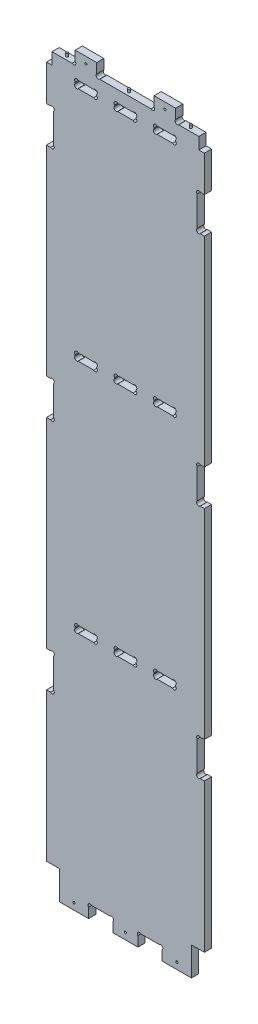
from build123d import *

# Parameters (mm, degrees)
BOSS_EXTRUDE1_DEPTH   = 10
SKETCH3_W             = 18
SKETCH3_H             = 40.02
CUT_EXTRUDE2_DEPTH    = 51
CAVITY2_START         = -19
CAVITY2_OUTLINE_W     = 80
CAVITY2_OUTLINE_H     = 10
CAVITY2_OUTLINE_R     = 1.5
CAVITY2_OUTLINE_W_2   = 32.3
CAVITY2_DEPTH         = 18
CAVITY2_START_2       = -1039.94
CAVITY2_2_OUTLINE_W   = 33.8
CAVITY2_2_OUTLINE_H   = 10
CAVITY2_2_OUTLINE_R   = 1.5
CAVITY2_2_DEPTH       = 18
CAVITY2_START_3       = -793.12
CAVITY2_3_OUTLINE_W   = 10
CAVITY2_3_OUTLINE_H   = 10
CAVITY2_3_DEPTH       = 50
CAVITY2_START_4       = -464.3
CAVITY2_4_OUTLINE_W   = 10
CAVITY2_4_OUTLINE_H   = 10
CAVITY2_4_DEPTH       = 50
CAVITY2_START_5       = -135.46
CAVITY2_5_OUTLINE_W   = 10
CAVITY2_5_OUTLINE_H   = 10
CAVITY2_5_DEPTH       = 50
CAVITY2_START_6       = -703.12
CAVITY2_6_DEPTH       = 10
CAVITY2_START_7       = -374.3
CAVITY2_7_DEPTH       = 10
CAVITY2_START_8       = -45.46
CAVITY2_8_DEPTH       = 10
F_3_0MM_DOWEL_HOLE1_D = 3
SKETCH7_R             = 3
CUT_EXTRUDE4_DEPTH    = 10
SKETCH6_W             = 80
SKETCH6_H             = 13.757359313
SKETCH6_W_2           = 32.3
CUT_EXTRUDE5_DEPTH    = 10
SKETCH8_W             = 30
SKETCH8_H             = 10
CUT_EXTRUDE6_DEPTH    = 10


# Read off the part's stored shape, not the designer's step: Cavity2
with BuildPart() as part:
    # Sketch1 → Boss-Extrude1 (new body)
    with BuildSketch(Plane.XY):
        Polygon((13, -35.36), (5.3, -35.36), (5.3, -1), (-199.3, -1), (-199.3, -35.36), (-207, -35.36), (-207, -1039.94), (13, -1039.94), align=None)
    extrude(amount=-BOSS_EXTRUDE1_DEPTH)

    # Sketch3 → Cut-Extrude2 (cut)
    with BuildSketch(Plane.XY):
        with Locations((-198, -1019.93)):
            Rectangle(SKETCH3_W, SKETCH3_H)
        with Locations((4, -1019.93)):
            Rectangle(SKETCH3_W, SKETCH3_H)
    extrude(amount=-CUT_EXTRUDE2_DEPTH, mode=Mode.SUBTRACT)

    # Cavity2 outline → Cavity2 (cut)
    # profile 1 of 3: a face of its own
    with BuildSketch(Plane(origin=(0, 0, 0), x_dir=(1, 0, 0), z_dir=(0, 1, 0)).offset(CAVITY2_START)):
        with Locations((-97, 5)):
            Rectangle(CAVITY2_OUTLINE_W, CAVITY2_OUTLINE_H)
        with Locations((-97, 5)):
            Circle(CAVITY2_OUTLINE_R, mode=Mode.SUBTRACT)
    # profile 2 of 3: a face of its own
    with BuildSketch(Plane(origin=(0, 0, 0), x_dir=(1, 0, 0), z_dir=(0, 1, 0)).offset(CAVITY2_START)):
        with Locations((-183.15, 5)):
            Rectangle(CAVITY2_OUTLINE_W_2, CAVITY2_OUTLINE_H)
        with Locations((-183.15, 5)):
            Circle(CAVITY2_OUTLINE_R, mode=Mode.SUBTRACT)
    # profile 3 of 3: a face of its own
    with BuildSketch(Plane(origin=(0, 0, 0), x_dir=(1, 0, 0), z_dir=(0, 1, 0)).offset(CAVITY2_START)):
        with Locations((-10.85, 5)):
            Rectangle(CAVITY2_OUTLINE_W_2, CAVITY2_OUTLINE_H)
        with Locations((-10.85, 5)):
            Circle(CAVITY2_OUTLINE_R, mode=Mode.SUBTRACT)
    extrude(amount=CAVITY2_DEPTH, mode=Mode.SUBTRACT)

    # Cavity2 2 outline → Cavity2 2 (cut)
    # profile 1 of 2: a face of its own
    with BuildSketch(Plane(origin=(0, 0, 0), x_dir=(1, 0, 0), z_dir=(0, 1, 0)).offset(CAVITY2_START_2)):
        with Locations((-131.4, 5)):
            Rectangle(CAVITY2_2_OUTLINE_W, CAVITY2_2_OUTLINE_H)
        with Locations((-131.4, 5)):
            Circle(CAVITY2_2_OUTLINE_R, mode=Mode.SUBTRACT)
    # profile 2 of 2: a face of its own
    with BuildSketch(Plane(origin=(0, 0, 0), x_dir=(1, 0, 0), z_dir=(0, 1, 0)).offset(CAVITY2_START_2)):
        with Locations((-62.6, 5)):
            Rectangle(CAVITY2_2_OUTLINE_W, CAVITY2_2_OUTLINE_H)
        with Locations((-62.6, 5)):
            Circle(CAVITY2_2_OUTLINE_R, mode=Mode.SUBTRACT)
    extrude(amount=CAVITY2_2_DEPTH, mode=Mode.SUBTRACT)

    # Cavity2 3 outline → Cavity2 3 (cut)
    with BuildSketch(Plane(origin=(0, 0, 0), x_dir=(1, 0, 0), z_dir=(0, 1, 0)).offset(CAVITY2_START_3)):
        with Locations((-202, 5)):
            Rectangle(CAVITY2_3_OUTLINE_W, CAVITY2_3_OUTLINE_H)
        with Locations((8, 5)):
            Rectangle(CAVITY2_3_OUTLINE_W, CAVITY2_3_OUTLINE_H)
    extrude(amount=CAVITY2_3_DEPTH, mode=Mode.SUBTRACT)

    # Cavity2 4 outline → Cavity2 4 (cut)
    with BuildSketch(Plane(origin=(0, 0, 0), x_dir=(1, 0, 0), z_dir=(0, 1, 0)).offset(CAVITY2_START_4)):
        with Locations((-202, 5)):
            Rectangle(CAVITY2_4_OUTLINE_W, CAVITY2_4_OUTLINE_H)
        with Locations((8, 5)):
            Rectangle(CAVITY2_4_OUTLINE_W, CAVITY2_4_OUTLINE_H)
    extrude(amount=CAVITY2_4_DEPTH, mode=Mode.SUBTRACT)

    # Cavity2 5 outline → Cavity2 5 (cut)
    with BuildSketch(Plane(origin=(0, 0, 0), x_dir=(1, 0, 0), z_dir=(0, 1, 0)).offset(CAVITY2_START_5)):
        with Locations((-202, 5)):
            Rectangle(CAVITY2_5_OUTLINE_W, CAVITY2_5_OUTLINE_H)
        with Locations((8, 5)):
            Rectangle(CAVITY2_5_OUTLINE_W, CAVITY2_5_OUTLINE_H)
    extrude(amount=CAVITY2_5_DEPTH, mode=Mode.SUBTRACT)

    # Cavity2 6 outline → Cavity2 6 (cut)
    with BuildSketch(Plane(origin=(0, 0, 0), x_dir=(1, 0, 0), z_dir=(0, 1, 0)).offset(CAVITY2_START_6)):
        with BuildLine():
            Line((-137, 0), (-137, 5.757359313))
            ThreePointArc((-137, 5.757359313), (-137.878679656, 7.878679657), (-137, 10))
            Line((-137, 10), (-167, 10))
            ThreePointArc((-167, 10), (-166.121320344, 7.878679657), (-167, 5.757359313))
            Line((-167, 5.757359313), (-167, 0))
            Line((-167, 0), (-137, 0))
        make_face()
        with BuildLine():
            Line((-112, 5.757359313), (-112, 0))
            Line((-112, 0), (-82, 0))
            Line((-82, 0), (-82, 5.757359313))
            ThreePointArc((-82, 5.757359313), (-82.878679656, 7.878679657), (-82, 10))
            Line((-82, 10), (-112, 10))
            ThreePointArc((-112, 10), (-111.121320344, 7.878679657), (-112, 5.757359313))
        make_face()
        with BuildLine():
            Line((-57, 5.757359313), (-57, 0))
            Line((-57, 0), (-27, 0))
            Line((-27, 0), (-27, 5.757359313))
            ThreePointArc((-27, 5.757359313), (-27.878679656, 7.878679657), (-27, 10))
            Line((-27, 10), (-57, 10))
            ThreePointArc((-57, 10), (-56.121320344, 7.878679657), (-57, 5.757359313))
        make_face()
    extrude(amount=CAVITY2_6_DEPTH, mode=Mode.SUBTRACT)

    # Cavity2 7 outline → Cavity2 7 (cut)
    with BuildSketch(Plane(origin=(0, 0, 0), x_dir=(1, 0, 0), z_dir=(0, 1, 0)).offset(CAVITY2_START_7)):
        with BuildLine():
            Line((-137, 0), (-137, 5.757359313))
            ThreePointArc((-137, 5.757359313), (-137.878679656, 7.878679657), (-137, 10))
            Line((-137, 10), (-167, 10))
            ThreePointArc((-167, 10), (-166.121320344, 7.878679657), (-167, 5.757359313))
            Line((-167, 5.757359313), (-167, 0))
            Line((-167, 0), (-137, 0))
        make_face()
        with BuildLine():
            Line((-112, 5.757359313), (-112, 0))
            Line((-112, 0), (-82, 0))
            Line((-82, 0), (-82, 5.757359313))
            ThreePointArc((-82, 5.757359313), (-82.878679656, 7.878679657), (-82, 10))
            Line((-82, 10), (-112, 10))
            ThreePointArc((-112, 10), (-111.121320344, 7.878679657), (-112, 5.757359313))
        make_face()
        with BuildLine():
            Line((-57, 5.757359313), (-57, 0))
            Line((-57, 0), (-27, 0))
            Line((-27, 0), (-27, 5.757359313))
            ThreePointArc((-27, 5.757359313), (-27.878679656, 7.878679657), (-27, 10))
            Line((-27, 10), (-57, 10))
            ThreePointArc((-57, 10), (-56.121320344, 7.878679657), (-57, 5.757359313))
        make_face()
    extrude(amount=CAVITY2_7_DEPTH, mode=Mode.SUBTRACT)

    # Cavity2 8 outline → Cavity2 8 (cut)
    with BuildSketch(Plane(origin=(0, 0, 0), x_dir=(1, 0, 0), z_dir=(0, 1, 0)).offset(CAVITY2_START_8)):
        with BuildLine():
            Line((-137, 0), (-137, 5.757359313))
            ThreePointArc((-137, 5.757359313), (-137.878679656, 7.878679657), (-137, 10))
            Line((-137, 10), (-167, 10))
            ThreePointArc((-167, 10), (-166.121320344, 7.878679657), (-167, 5.757359313))
            Line((-167, 5.757359313), (-167, 0))
            Line((-167, 0), (-137, 0))
        make_face()
        with BuildLine():
            Line((-112, 5.757359313), (-112, 0))
            Line((-112, 0), (-82, 0))
            Line((-82, 0), (-82, 5.757359313))
            ThreePointArc((-82, 5.757359313), (-82.878679656, 7.878679657), (-82, 10))
            Line((-82, 10), (-112, 10))
            ThreePointArc((-112, 10), (-111.121320344, 7.878679657), (-112, 5.757359313))
        make_face()
        with BuildLine():
            Line((-57, 5.757359313), (-57, 0))
            Line((-57, 0), (-27, 0))
            Line((-27, 0), (-27, 5.757359313))
            ThreePointArc((-27, 5.757359313), (-27.878679656, 7.878679657), (-27, 10))
            Line((-27, 10), (-57, 10))
            ThreePointArc((-57, 10), (-56.121320344, 7.878679657), (-57, 5.757359313))
        make_face()
    extrude(amount=CAVITY2_8_DEPTH, mode=Mode.SUBTRACT)

    # Ø3.0mm Dowel Hole1 (through all)
    with Locations(Plane.XY):
        with Locations((-25.35, -1030.94), (-152, -10), (-42, -10), (-168.65, -1030.94), (-97, -1030.94)):
            Hole(F_3_0MM_DOWEL_HOLE1_D / 2)

    # Sketch7 → Cut-Extrude4 (cut)
    with BuildSketch(Plane.XY):
        with Locations((-134.878679656, -16.878679657)):
            Circle(SKETCH7_R)
        with Locations((-59.121320344, -16.878679657)):
            Circle(SKETCH7_R)
        with Locations((5.121320344, -133.338679656)):
            Circle(SKETCH7_R)
        with Locations((5.121320344, -87.581320344)):
            Circle(SKETCH7_R)
        with Locations((5.121320344, -416.421320344)):
            Circle(SKETCH7_R)
        with Locations((5.121320344, -462.178679657)):
            Circle(SKETCH7_R)
        with Locations((5.121320344, -790.998679657)):
            Circle(SKETCH7_R)
        with Locations((5.121320344, -745.241320344)):
            Circle(SKETCH7_R)
        with Locations((-199.121320344, -790.998679657)):
            Circle(SKETCH7_R)
        with Locations((-199.121320344, -745.241320344)):
            Circle(SKETCH7_R)
        with Locations((-199.121320344, -462.178679657)):
            Circle(SKETCH7_R)
        with Locations((-199.121320344, -416.421320344)):
            Circle(SKETCH7_R)
        with Locations((-199.121320344, -87.581320344)):
            Circle(SKETCH7_R)
        with Locations((-199.121320344, -133.338679656)):
            Circle(SKETCH7_R)
        with Locations((-146.178679656, -1024.061320344)):
            Circle(SKETCH7_R)
        with Locations((-116.621320344, -1024.061320344)):
            Circle(SKETCH7_R)
        with Locations((-77.378679656, -1024.061320344)):
            Circle(SKETCH7_R)
        with Locations((-47.821320344, -1024.061320344)):
            Circle(SKETCH7_R)
        with Locations((-169.121320344, -16.878679657)):
            Circle(SKETCH7_R)
        with Locations((-24.878679656, -16.878679657)):
            Circle(SKETCH7_R)
        with BuildLine():
            ThreePointArc((-164.034165929, -40.46), (-164.878679656, -34.581320344), (-165.723193384, -40.46))
            ThreePointArc((-165.723193384, -40.46), (-164.878679656, -46.338679656), (-164.034165929, -40.46))
        make_face()
        with BuildLine():
            ThreePointArc((-55.723193384, -40.46), (-54.878679656, -46.338679656), (-54.034165929, -40.46))
            ThreePointArc((-54.034165929, -40.46), (-54.878679656, -34.581320344), (-55.723193384, -40.46))
        make_face()
        with BuildLine():
            ThreePointArc((-138.276806616, -40.46), (-139.121320344, -34.581320344), (-139.965834071, -40.46))
            ThreePointArc((-139.965834071, -40.46), (-139.121320344, -46.338679656), (-138.276806616, -40.46))
        make_face()
        with BuildLine():
            ThreePointArc((-29.965834071, -40.46), (-29.121320344, -46.338679656), (-28.276806616, -40.46))
            ThreePointArc((-28.276806616, -40.46), (-29.121320344, -34.581320344), (-29.965834071, -40.46))
        make_face()
        with BuildLine():
            ThreePointArc((-110.723193384, -40.46), (-109.878679656, -46.338679656), (-109.034165929, -40.46))
            ThreePointArc((-109.034165929, -40.46), (-109.878679656, -34.581320344), (-110.723193384, -40.46))
        make_face()
        with BuildLine():
            ThreePointArc((-84.965834071, -40.46), (-84.121320344, -46.338679656), (-83.276806616, -40.46))
            ThreePointArc((-83.276806616, -40.46), (-84.121320344, -34.581320344), (-84.965834071, -40.46))
        make_face()
        with BuildLine():
            ThreePointArc((-164.034165929, -369.3), (-164.878679656, -363.421320344), (-165.723193384, -369.3))
            ThreePointArc((-165.723193384, -369.3), (-164.878679656, -375.178679657), (-164.034165929, -369.3))
        make_face()
        with BuildLine():
            ThreePointArc((-138.276806616, -369.3), (-139.121320344, -363.421320344), (-139.965834071, -369.3))
            ThreePointArc((-139.965834071, -369.3), (-139.121320344, -375.178679657), (-138.276806616, -369.3))
        make_face()
        with BuildLine():
            ThreePointArc((-109.034165929, -369.3), (-109.878679656, -363.421320344), (-110.723193384, -369.3))
            ThreePointArc((-110.723193384, -369.3), (-109.878679656, -375.178679657), (-109.034165929, -369.3))
        make_face()
        with BuildLine():
            ThreePointArc((-83.276806616, -369.3), (-84.121320344, -363.421320344), (-84.965834071, -369.3))
            ThreePointArc((-84.965834071, -369.3), (-84.121320344, -375.178679657), (-83.276806616, -369.3))
        make_face()
        with BuildLine():
            ThreePointArc((-54.034165929, -369.3), (-54.878679656, -363.421320344), (-55.723193384, -369.3))
            ThreePointArc((-55.723193384, -369.3), (-54.878679656, -375.178679657), (-54.034165929, -369.3))
        make_face()
        with BuildLine():
            ThreePointArc((-28.276806616, -369.3), (-29.121320344, -363.421320344), (-29.965834071, -369.3))
            ThreePointArc((-29.965834071, -369.3), (-29.121320344, -375.178679657), (-28.276806616, -369.3))
        make_face()
        with BuildLine():
            ThreePointArc((-164.034165929, -698.12), (-164.878679656, -692.241320344), (-165.723193384, -698.12))
            ThreePointArc((-165.723193384, -698.12), (-164.878679656, -703.998679657), (-164.034165929, -698.12))
        make_face()
        with BuildLine():
            ThreePointArc((-139.965834071, -698.12), (-139.121320344, -703.998679657), (-138.276806616, -698.12))
            ThreePointArc((-138.276806616, -698.12), (-139.121320344, -692.241320344), (-139.965834071, -698.12))
        make_face()
        with BuildLine():
            ThreePointArc((-109.034165929, -698.12), (-109.878679656, -692.241320344), (-110.723193384, -698.12))
            ThreePointArc((-110.723193384, -698.12), (-109.878679656, -703.998679657), (-109.034165929, -698.12))
        make_face()
        with BuildLine():
            ThreePointArc((-84.965834071, -698.12), (-84.121320344, -703.998679657), (-83.276806616, -698.12))
            ThreePointArc((-83.276806616, -698.12), (-84.121320344, -692.241320344), (-84.965834071, -698.12))
        make_face()
        with BuildLine():
            ThreePointArc((-54.034165929, -698.12), (-54.878679656, -692.241320344), (-55.723193384, -698.12))
            ThreePointArc((-55.723193384, -698.12), (-54.878679656, -703.998679657), (-54.034165929, -698.12))
        make_face()
        with BuildLine():
            ThreePointArc((-29.965834071, -698.12), (-29.121320344, -703.998679657), (-28.276806616, -698.12))
            ThreePointArc((-28.276806616, -698.12), (-29.121320344, -692.241320344), (-29.965834071, -698.12))
        make_face()
    extrude(amount=-CUT_EXTRUDE4_DEPTH, mode=Mode.SUBTRACT)

    # Sketch6 → Cut-Extrude5 (cut)
    with BuildSketch(Plane.XY):
        with Locations((-97, -7.878679657)):
            Rectangle(SKETCH6_W, SKETCH6_H)
        Polygon((-148.3, -1039.94), (-114.5, -1039.94), (-114.5, -1026.182640687), (-118.742640687, -1026.182640687), (-118.742640687, -1021.94), (-144.057359313, -1021.94), (-144.057359313, -1026.182640687), (-148.3, -1026.182640687), align=None)
        Polygon((-79.5, -1039.94), (-45.7, -1039.94), (-45.7, -1026.182640687), (-49.942640687, -1026.182640687), (-49.942640687, -1021.94), (-75.257359313, -1021.94), (-75.241477029, -1026.182640687), (-79.5, -1026.182640687), align=None)
        with Locations((-10.85, -7.878679657)):
            Rectangle(SKETCH6_W_2, SKETCH6_H)
        with Locations((-183.15, -7.878679657)):
            Rectangle(SKETCH6_W_2, SKETCH6_H)
    extrude(amount=-CUT_EXTRUDE5_DEPTH, mode=Mode.SUBTRACT)

    # Sketch8 → Cut-Extrude6 (cut)
    with BuildSketch(Plane.XY):
        with Locations((-97, -40.46)):
            Rectangle(SKETCH8_W, SKETCH8_H)
        with Locations((-152, -40.46)):
            Rectangle(SKETCH8_W, SKETCH8_H)
        with Locations((-42, -40.46)):
            Rectangle(SKETCH8_W, SKETCH8_H)
        with Locations((-152, -369.3)):
            Rectangle(SKETCH8_W, SKETCH8_H)
        with Locations((-97, -369.3)):
            Rectangle(SKETCH8_W, SKETCH8_H)
        with Locations((-42, -369.3)):
            Rectangle(SKETCH8_W, SKETCH8_H)
        with Locations((-42, -698.12)):
            Rectangle(SKETCH8_W, SKETCH8_H)
        with Locations((-152, -698.12)):
            Rectangle(SKETCH8_W, SKETCH8_H)
        with Locations((-97, -698.12)):
            Rectangle(SKETCH8_W, SKETCH8_H)
    extrude(amount=-CUT_EXTRUDE6_DEPTH, mode=Mode.SUBTRACT)


solid = part.part
